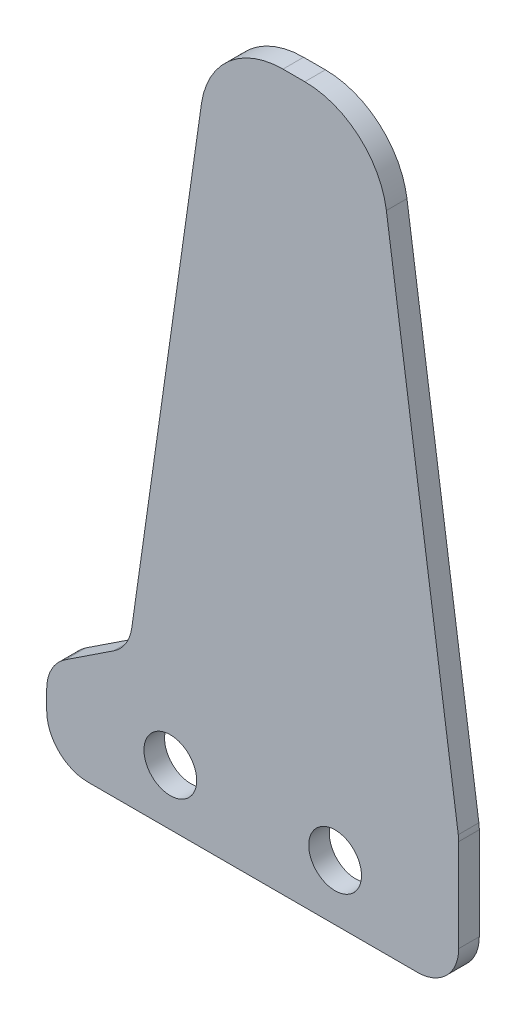
from build123d import *

# Parameters (mm, degrees)
SKETCH1_R           = 2.032
BOSS_EXTRUDE1_DEPTH = 1.5875
FILLET1_R           = 6.35
FILLET2_R           = 3.175


with BuildPart() as part:
    # Sketch1 → Boss-Extrude1 (new body)
    with BuildSketch(Plane.XY):
        Polygon((9.525, -4.304228224), (9.525, 6.236022628), (3.175, 50.8), (-9.525, 50.8), (-15.875, 6.236022628), (-22.225, 2.045771776), (-22.225, -4.304228224), align=None)
        Circle(SKETCH1_R, mode=Mode.SUBTRACT)
        with Locations((-12.7, 0)):
            Circle(SKETCH1_R, mode=Mode.SUBTRACT)
    extrude(amount=BOSS_EXTRUDE1_DEPTH)

    # Fillet1
    fillet1_edges = [part.edges().sort_by_distance(p)[0] for p in [
        (-9.525, 50.8, 0.79375),
        (3.175, 50.8, 0.79375),
    ]]
    fillet(fillet1_edges, radius=FILLET1_R)

    # Fillet2
    fillet2_edges = [part.edges().sort_by_distance(p)[0] for p in [
        (9.525, 6.236022628, 0.79375),
        (9.525, -4.304228224, 0.79375),
        (-22.225, -4.304228224, 0.79375),
        (-22.225, 2.045771776, 0.79375),
        (-15.875, 6.236022628, 0.79375),
    ]]
    fillet(fillet2_edges, radius=FILLET2_R)


solid = part.part
